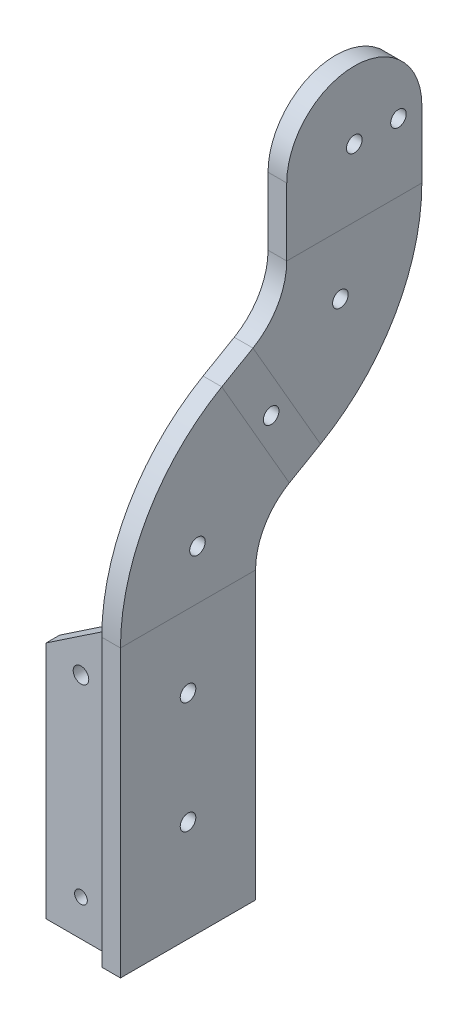
from build123d import *

# Parameters (mm, degrees)
SKETCH_2_W                = 3.6
SKETCH_2_H                = 26
SKETCH_3_W                = 17
SKETCH_3_H                = 33
EXTRUDE_1_DEPTH           = 4
RIB_START                 = -1.3
RIB_1_DEPTH               = 2.6
SKETCH_5_R                = 1.5
SKETCH_5_R_2              = 1.224086187
CUT_EXTRUDE_1_DEPTH       = 4
CUT_EXTRUDE_2_DEPTH       = 4
SKETCH_7_R                = 1.5
CUT_EXTRUDE_3_DEPTH       = 4
CUT_EXTRUDE_4_DEPTH       = 1.2
CUT_EXTRUDE_4_DRAFT       = -30
HOLE_WIZARD_1_D           = 3
HOLE_WIZARD_1_CBORE_D     = 5
HOLE_WIZARD_1_CBORE_DEPTH = 1.6
CUT_EXTRUDE_6_DEPTH       = 135.185107528
SKETCH_25_R               = 1.5
CUT_EXTRUDE_8_DEPTH       = 139.143340278


# Read off the part's stored shape, not the designer's step: 筋1
with BuildPart() as part:
    # 扫描1: sweep along a path in 草图1
    with BuildLine(Plane(origin=(0, 0, 0), x_dir=(0, 0, -1), z_dir=(1, 0, 0))) as sweep_1_path:
        Line((0, 0), (0, 55))
        ThreePointArc((0, 55), (3.483339502, 68), (13, 77.516660498))
        Line((13, 77.516660498), (19, 80.980762114))
        ThreePointArc((19, 80.980762114), (28.516660498, 90.497422612), (32, 103.497422612))
        Line((32, 103.497422612), (32, 129.497422612))
    # 草图2 → 扫描1 (sweep)
    with BuildSketch(Plane(origin=(0, 0, 0), x_dir=(1, 0, 0), z_dir=(0, 1, 0))):
        Rectangle(SKETCH_2_W, SKETCH_2_H)
    sweep(path=sweep_1_path.line)

    # 草图3 → 凸台-拉伸1 (add)
    with BuildSketch(Plane.XZ):
        with Locations((-6.7, 3.5)):
            Rectangle(SKETCH_3_W, SKETCH_3_H)
    extrude(amount=-EXTRUDE_1_DEPTH)

    # 筋1 outline → 筋1 (add)
    with BuildSketch(Plane.XY.offset(9).offset(RIB_START)):
        Polygon((-1.8, 55), (-15.2, 46), (-15.2, 4), (-1.8, 4), align=None)
    extrude(amount=RIB_1_DEPTH)

    # 草图5 → 切除-拉伸1 (cut)
    with BuildSketch(Plane.XY.offset(10.3)):
        with Locations((-8.5, 44)):
            Circle(SKETCH_5_R)
        with Locations((-8.5, 7)):
            Circle(SKETCH_5_R_2)
    extrude(amount=-CUT_EXTRUDE_1_DEPTH, mode=Mode.SUBTRACT)

    # 草图6 → 切除-拉伸2 (cut)
    with BuildSketch(Plane.ZY.offset(1.8)):
        with BuildLine():
            Line((-45, 129.497422612), (-45, 116.497422612))
            ThreePointArc((-45, 116.497422612), (-41.192388155, 125.689810767), (-32, 129.497422612))
            Line((-32, 129.497422612), (-45, 129.497422612))
        make_face()
        with BuildLine():
            ThreePointArc((-32, 129.497422612), (-22.807611845, 125.689810767), (-19, 116.497422612))
            Line((-19, 116.497422612), (-19, 129.497422612))
            Line((-19, 129.497422612), (-32, 129.497422612))
        make_face()
    extrude(amount=-CUT_EXTRUDE_2_DEPTH, mode=Mode.SUBTRACT)

    # 草图7 → 切除-拉伸3 (cut)
    with BuildSketch(Plane(origin=(1.8, 0, 0), x_dir=(0, 0, -1), z_dir=(1, 0, 0))):
        with Locations((32, 116.497422612)):
            Circle(SKETCH_7_R)
        with Locations((40.5, 116.497422612)):
            Circle(SKETCH_7_R)
    extrude(amount=-CUT_EXTRUDE_3_DEPTH, mode=Mode.SUBTRACT)


with BuildPart() as cut_extrude_4_tool:
    # 草图8 → 切除-拉伸4 (with draft: the straight prism first)
    with BuildSketch(Plane.ZY.offset(1.8)):
        with BuildLine():
            Line((6, 10), (6, 55))
            ThreePointArc((6, 55), (1.712812921, 71), (-10, 82.712812921))
            Line((-10, 82.712812921), (-16, 86.176914536))
            ThreePointArc((-16, 86.176914536), (-22.383040886, 92.025893885), (-25.69615506, 100.024459059))
            ThreePointArc((-25.69615506, 100.024459059), (-32.646890644, 104.891416511), (-37.513848096, 97.940680927))
            ThreePointArc((-37.513848096, 97.940680927), (-32.212865417, 85.142976649), (-22, 75.784609691))
            Line((-22, 75.784609691), (-16, 72.320508076))
            ThreePointArc((-16, 72.320508076), (-8.679491924, 65), (-6, 55))
            Line((-6, 55), (-6, 10))
            Line((-6, 10), (6, 10))
        make_face()
    extrude(amount=-CUT_EXTRUDE_4_DEPTH)
    # 切除-拉伸4: the draft: its side faces are tilted about the plane it starts from
    cut_extrude_4_sides = [cut_extrude_4_tool.faces().sort_by_distance(p)[0] for p in [
        (-1.2, 32.5, 6),
        (-1.2, 71, 1.712812921),
        (-1.2, 84.444863729, -13),
        (-1.2, 92.025893885, -22.383040886),
        (-1.2, 104.891416511, -32.646890644),
        (-1.2, 85.142976649, -32.212865417),
        (-1.2, 74.052558883, -19),
        (-1.2, 65, -8.679491924),
        (-1.2, 32.5, -6),
        (-1.2, 10, 0),
    ]]
    draft(cut_extrude_4_sides, Plane.ZY.offset(1.8), CUT_EXTRUDE_4_DRAFT)


with BuildPart() as part_1:
    add(part.part)

    # 切除-拉伸4: cut by cut_extrude_4_tool
    add(cut_extrude_4_tool.part, mode=Mode.SUBTRACT)

    # 孔1 (through all)
    with Locations(Plane(origin=(0, 4, 0), x_dir=(1, 0, 0), z_dir=(0, 1, 0))):
        with Locations((-8.5, 7.65), (-8.5, -2.35)):
            CounterBoreHole(HOLE_WIZARD_1_D / 2, HOLE_WIZARD_1_CBORE_D / 2, HOLE_WIZARD_1_CBORE_DEPTH)

    # 草图18 → 切除-拉伸6 (cut, through all)
    with BuildSketch(Plane(origin=(0, 4, 0), x_dir=(1, 0, 0), z_dir=(0, 1, 0))):
        Polygon((-1.8, -13), (-1.8, -10.3), (-15.2, -10.3), (-15.2, -20), (1.8, -20), (1.8, -13), align=None)
    extrude(amount=-CUT_EXTRUDE_6_DEPTH, mode=Mode.SUBTRACT)

    # 草图25 → 切除-拉伸8 (cut, through all)
    with BuildSketch(Plane(origin=(1.8, 0, 0), x_dir=(0, 0, -1), z_dir=(1, 0, 0))):
        with Locations((0, 19.490691587)):
            Circle(SKETCH_25_R)
    cut_extrude_8 = extrude(amount=-CUT_EXTRUDE_8_DEPTH, mode=Mode.SUBTRACT)

    # 草图阵列1: 切除-拉伸8 at 4 more places
    with Locations((0, 21.499351, 0), (0, 45.068964, -1.821229), (0, 72.524124, -29.327017), (0, 59.75802, -16)):
        add(cut_extrude_8, mode=Mode.SUBTRACT)


solid = part_1.part
